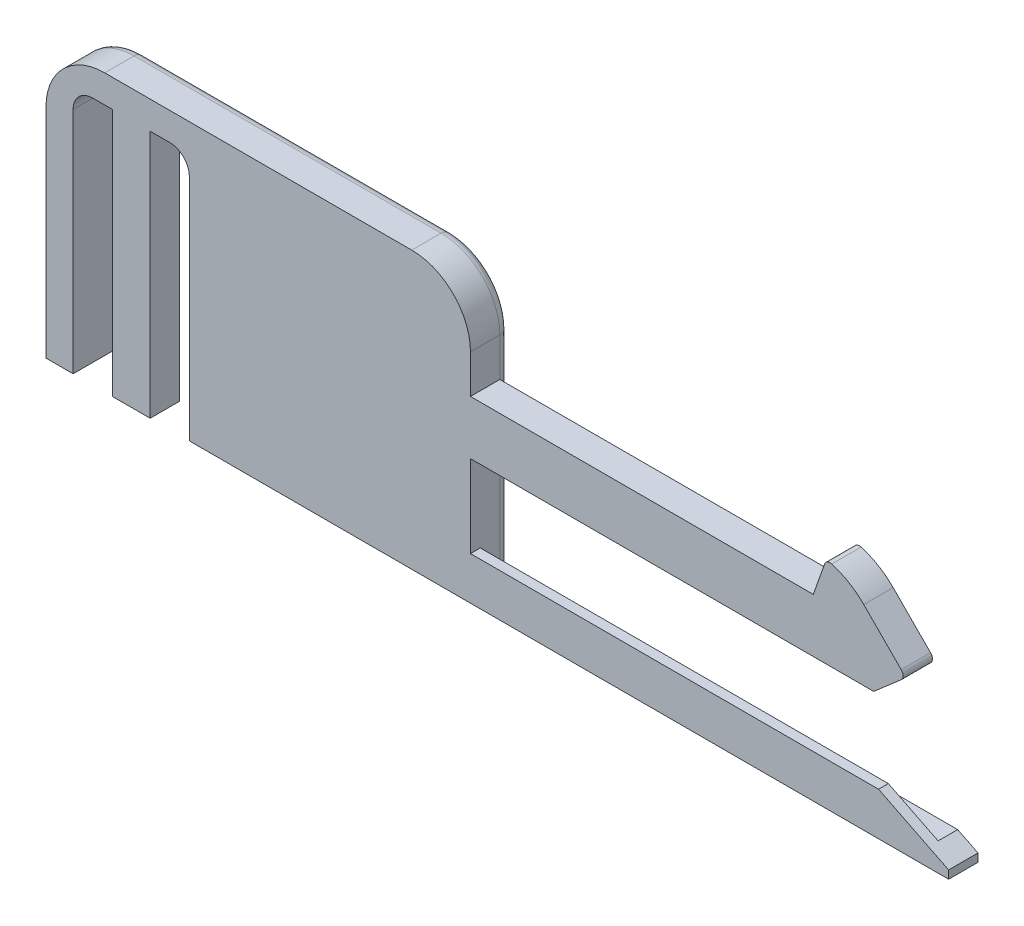
from build123d import *

# Parameters (mm, degrees)
EXTRUDE1_DEPTH          = 5.08
EXTRUDE2_DEPTH          = 1.27
EXTRUDE3_DEPTH          = 3.81
SKETCH1_5_W             = 4.91012523
SKETCH1_5_H             = 32.245498845
EXTRUDE4_DEPTH          = 3.81
FILLET2_R               = 1.27
FILLET3_R               = 1.27
CUT_EXTRUDE1_DEPTH      = 123.54722299
CUT_EXTRUDE1_DEPTH_BACK = 123.54722299


with BuildPart() as part:
    # Sketch1 → Extrude1 (new, symmetric)
    with BuildSketch(Plane.XY):
        with BuildLine():
            Line((55.053954756, 23.223525864), (55.053954756, 28.234899079))
            ThreePointArc((55.053954756, 28.234899079), (52.822108428, 33.623052752), (47.433954756, 35.854899079))
            Line((47.433954756, 35.854899079), (7.62, 35.854899079))
            ThreePointArc((7.62, 35.854899079), (2.231846327, 33.623052752), (0, 28.234899079))
            Line((0, 28.234899079), (0, -28.234899079))
            ThreePointArc((0, -28.234899079), (2.231846327, -33.623052752), (7.62, -35.854899079))
            Line((7.62, -35.854899079), (47.433954756, -35.854899079))
            ThreePointArc((47.433954756, -35.854899079), (52.822108428, -33.623052752), (55.053954756, -28.234899079))
            Line((55.053954756, -28.234899079), (55.053954756, -23.223525864))
            Line((55.053954756, -23.223525864), (55.053954756, -19.324782682))
            Line((55.053954756, -19.324782682), (55.053954756, -16.240810389))
            Line((55.053954756, -16.240810389), (55.053954756, -5.571934871))
            Line((55.053954756, -5.571934871), (55.053954756, -2.359181621))
            Line((55.053954756, -2.359181621), (55.053954756, 2.359181621))
            Line((55.053954756, 2.359181621), (55.053954756, 5.571934871))
            Line((55.053954756, 5.571934871), (55.053954756, 16.240810389))
            Line((55.053954756, 16.240810389), (55.053954756, 19.324782682))
            Line((55.053954756, 19.324782682), (55.053954756, 23.223525864))
        make_face()
        with BuildLine():
            ThreePointArc((16.048576777, 32.245498845), (17.844628001, 31.501550069), (18.588576777, 29.705498845))
            Line((18.588576777, 29.705498845), (18.588576777, 27.618036038))
            Line((18.588576777, 27.618036038), (41.829183295, 27.618036038))
            ThreePointArc((41.829183295, 27.618036038), (46.643426698, 25.623911128), (48.637551607, 20.809667725))
            Line((48.637551607, 20.809667725), (48.637551607, -20.809667725))
            ThreePointArc((48.637551607, -20.809667725), (46.643426698, -25.623911128), (41.829183295, -27.618036038))
            Line((41.829183295, -27.618036038), (18.588576777, -27.618036038))
            Line((18.588576777, -27.618036038), (18.588576777, -29.705498845))
            ThreePointArc((18.588576777, -29.705498845), (17.844628001, -31.501550069), (16.048576777, -32.245498845))
            Line((16.048576777, -32.245498845), (13.508576777, -32.245498845))
            Line((13.508576777, -32.245498845), (8.598451547, -32.245498845))
            Line((8.598451547, -32.245498845), (6.058451547, -32.245498845))
            ThreePointArc((6.058451547, -32.245498845), (4.262400322, -31.501550069), (3.518451547, -29.705498845))
            Line((3.518451547, -29.705498845), (3.518451547, 29.705498845))
            ThreePointArc((3.518451547, 29.705498845), (4.262400322, 31.501550069), (6.058451547, 32.245498845))
            Line((6.058451547, 32.245498845), (8.598451547, 32.245498845))
            Line((8.598451547, 32.245498845), (13.508576777, 32.245498845))
            Line((13.508576777, 32.245498845), (16.048576777, 32.245498845))
        make_face(mode=Mode.SUBTRACT)
    extrude(amount=EXTRUDE1_DEPTH, both=True)

    # Sketch1<3> → Extrude2 (add, symmetric)
    with BuildSketch(Plane.XY):
        Polygon((110.911701022, 19.324782682), (55.053954756, 19.324782682), (55.053954756, 16.240810389), (107.354901489, 16.240810389), align=None)
        Polygon((114.44157437, -2.359181621), (55.053954756, -2.359181621), (55.053954756, -5.571934871), (107.985089149, -5.571934871), align=None)
        Polygon((107.985089149, 5.571934871), (55.053954756, 5.571934871), (55.053954756, 2.359181621), (114.44157437, 2.359181621), align=None)
        Polygon((107.354901489, -16.240810389), (55.053954756, -16.240810389), (55.053954756, -19.324782682), (110.911701022, -19.324782682), align=None)
    extrude(amount=EXTRUDE2_DEPTH, both=True)

    # Sketch1<4> → Extrude3 (add, symmetric)
    with BuildSketch(Plane.XY):
        with BuildLine():
            Line((99.519849351, 23.223525864), (55.053954756, 23.223525864))
            Line((55.053954756, 23.223525864), (55.053954756, 19.324782682))
            Line((55.053954756, 19.324782682), (110.911701022, 19.324782682))
            ThreePointArc((110.911701022, 19.324782682), (111.174479609, 19.893330482), (110.922452685, 20.466725298))
            Line((110.922452685, 20.466725298), (106.069134127, 25.355454719))
            ThreePointArc((106.069134127, 25.355454719), (104.150057648, 26.85581949), (101.918508412, 27.832618847))
            ThreePointArc((101.918508412, 27.832618847), (101.356567079, 27.780652221), (100.984486575, 27.356347272))
            Line((100.984486575, 27.356347272), (99.519849351, 23.223525864))
        make_face()
        Polygon((114.44157437, 2.359181621), (55.053954756, 2.359181621), (55.053954756, -2.359181621), (114.44157437, -2.359181621), (117.074513308, -1.049028675), (117.074513308, 1.049028675), align=None)
        with BuildLine():
            Line((55.053954756, -19.324782682), (55.053954756, -23.223525864))
            Line((55.053954756, -23.223525864), (99.519849351, -23.223525864))
            Line((99.519849351, -23.223525864), (101.216749822, -28.011733127))
            ThreePointArc((101.216749822, -28.011733127), (103.835645626, -27.035617331), (106.069134127, -25.355454719))
            Line((106.069134127, -25.355454719), (110.922452685, -20.466725298))
            ThreePointArc((110.922452685, -20.466725298), (111.174479609, -19.893330482), (110.911701022, -19.324782682))
            Line((110.911701022, -19.324782682), (55.053954756, -19.324782682))
        make_face()
    extrude(amount=EXTRUDE3_DEPTH, both=True)

    # Sketch1<5> → Extrude4 (add, symmetric)
    with BuildSketch(Plane.XY):
        with BuildLine():
            Line((48.637551607, 0), (18.588576777, 0))
            Line((18.588576777, 0), (18.588576777, -27.618036038))
            Line((18.588576777, -27.618036038), (41.829183295, -27.618036038))
            ThreePointArc((41.829183295, -27.618036038), (46.643426698, -25.623911128), (48.637551607, -20.809667725))
            Line((48.637551607, -20.809667725), (48.637551607, 0))
        make_face()
        with BuildLine():
            Line((18.588576777, 27.618036038), (18.588576777, 0))
            Line((18.588576777, 0), (48.637551607, 0))
            Line((48.637551607, 0), (48.637551607, 20.809667725))
            ThreePointArc((48.637551607, 20.809667725), (46.643426698, 25.623911128), (41.829183295, 27.618036038))
            Line((41.829183295, 27.618036038), (18.588576777, 27.618036038))
        make_face()
        with Locations((11.053514162, -16.122749423)):
            Rectangle(SKETCH1_5_W, SKETCH1_5_H)
        with Locations((11.053514162, 16.122749423)):
            Rectangle(SKETCH1_5_W, SKETCH1_5_H)
    extrude(amount=EXTRUDE4_DEPTH, both=True)

    # Fillet2
    fillet2_edges = [part.edges().sort_by_distance(p)[0] for p in [
        (30.208880036, -27.618036038, -3.81),
        (30.208880036, -27.618036038, 3.81),
        (46.643426698, -25.623911128, -3.81),
        (46.643426698, -25.623911128, 3.81),
        (48.637551607, 0, -3.81),
        (48.637551607, 0, 3.81),
        (46.643426698, 25.623911128, -3.81),
        (46.643426698, 25.623911128, 3.81),
        (30.208880036, 27.618036038, -3.81),
        (30.208880036, 27.618036038, 3.81),
    ]]
    fillet(fillet2_edges, radius=FILLET2_R - 0.0001)  # a hair under: the kernel refuses the full size

    # Fillet3
    fillet3_edges = [part.edges().sort_by_distance(p)[0] for p in [
        (2.231846327, 33.623052752, -5.08),
        (27.526977378, 35.854899079, -5.08),
        (52.822108428, 33.623052752, -5.08),
        (55.053954756, 0, -5.08),
        (52.822108428, -33.623052752, -5.08),
        (27.526977378, -35.854899079, -5.08),
        (2.231846327, -33.623052752, -5.08),
        (0, 0, -5.08),
        (0, 0, 5.08),
        (2.231846327, -33.623052752, 5.08),
        (27.526977378, -35.854899079, 5.08),
        (52.822108428, -33.623052752, 5.08),
        (55.053954756, 0, 5.08),
        (52.822108428, 33.623052752, 5.08),
        (27.526977378, 35.854899079, 5.08),
        (2.231846327, 33.623052752, 5.08),
    ]]
    fillet(fillet3_edges, radius=FILLET3_R - 0.0001)  # a hair under: the kernel refuses the full size

    # Sketch2 → Cut-Extrude1 (cut, two sides: drawn at the far end of the back side and taken through both)
    with BuildSketch(Plane(origin=(117.074513308, 0, 0), x_dir=(0, 0, -1), z_dir=(1, 0, 0)).offset(-CUT_EXTRUDE1_DEPTH_BACK)):
        Polygon((158.859018875, 0), (5.08, 0), (0, 0), (0, 35.854899079), (0, 189.633917954), (-235.763888228, -7.868830363), (-76.904869352, -197.502748317), align=None)
    extrude(amount=CUT_EXTRUDE1_DEPTH + CUT_EXTRUDE1_DEPTH_BACK, mode=Mode.SUBTRACT)


solid = part.part
